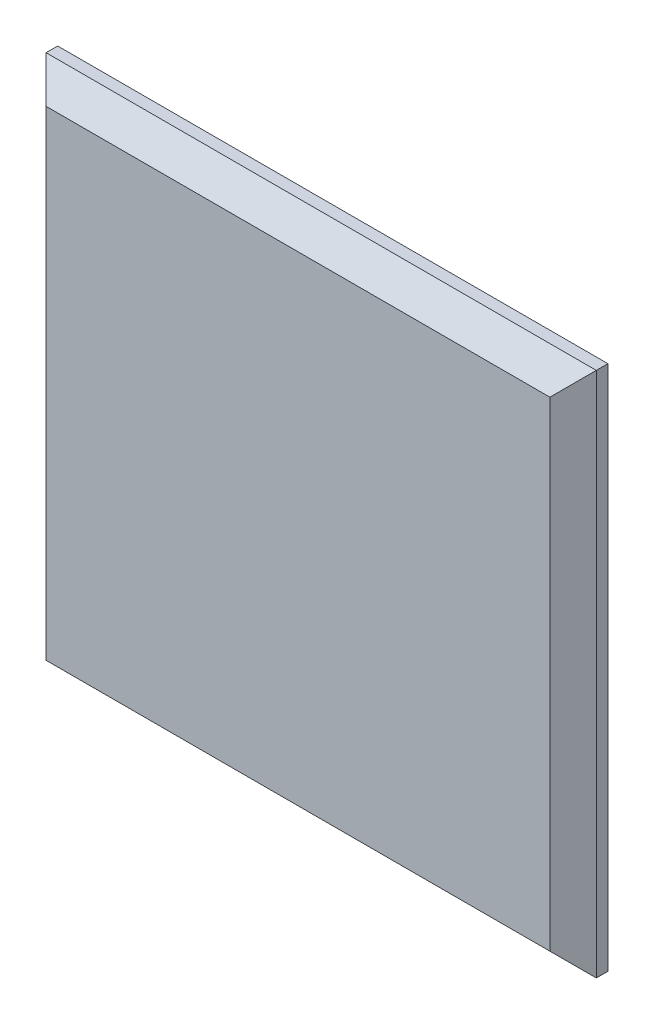
from build123d import *

# Parameters (mm, degrees)
SKETCH1_W           = 142.2
SKETCH1_H           = 136
BOSS_EXTRUDE1_DEPTH = 6
SKETCH2_W           = 142.2
SKETCH2_H           = 136
BOSS_EXTRUDE2_DEPTH = 3
CHAMFER1_SIZE       = 6
CHAMFER2_SIZE       = 4
SKETCH3_R           = 1.55
CUT_EXTRUDE1_DEPTH  = 2.3


with BuildPart() as part:
    # Sketch1 → Boss-Extrude1 (new body)
    with BuildSketch(Plane.XY):
        with Locations((-71.1, 68)):
            Rectangle(SKETCH1_W, SKETCH1_H)
        with BuildLine():
            ThreePointArc((-5, 9.5), (-7.121320344, 8.621320344), (-8, 6.5))
            Line((-8, 6.5), (-8, 5))
            Line((-8, 5), (-132.7, 5))
            Line((-132.7, 5), (-132.7, 6.5))
            ThreePointArc((-132.7, 6.5), (-133.578679656, 8.621320344), (-135.7, 9.5))
            Line((-135.7, 9.5), (-137.2, 9.5))
            Line((-137.2, 9.5), (-137.2, 126.5))
            Line((-137.2, 126.5), (-135.7, 126.5))
            ThreePointArc((-135.7, 126.5), (-133.578679656, 127.378679656), (-132.7, 129.5))
            Line((-132.7, 129.5), (-132.7, 131))
            Line((-132.7, 131), (-8, 131))
            Line((-8, 131), (-8, 129.5))
            ThreePointArc((-8, 129.5), (-7.121320344, 127.378679656), (-5, 126.5))
            Line((-5, 126.5), (-5, 9.5))
        make_face(mode=Mode.SUBTRACT)
    extrude(amount=BOSS_EXTRUDE1_DEPTH)

    # Sketch2 → Boss-Extrude2 (add)
    with BuildSketch(Plane.XY.offset(6)):
        with Locations((-71.1, 68)):
            Rectangle(SKETCH2_W, SKETCH2_H)
    extrude(amount=BOSS_EXTRUDE2_DEPTH)

    # Chamfer1
    chamfer1_edges = [part.edges().sort_by_distance(p)[0] for p in [
        (-142.2, 68, 9),
        (-71.1, 0, 9),
        (0, 68, 9),
        (-71.1, 136, 9),
    ]]
    chamfer(chamfer1_edges, length=CHAMFER1_SIZE)

    # Chamfer2
    # the kernel refuses this chamfer: 4 mm, written as the material it adds along each edge
    with BuildSketch(Plane(origin=(-142.986731952, 131, 6), x_dir=(0, 0.02749587661058907, -0.9996219169112965), z_dir=(1, 0, 0))) as chamfer2_piece_1_section:
        Polygon((CHAMFER2_SIZE * 0.999621916911, -CHAMFER2_SIZE * 0.0274958766106), (-CHAMFER2_SIZE * 0.0274958766106, -CHAMFER2_SIZE * 0.999621916911), (0, 0), align=None)
    chamfer2_piece_1 = extrude(amount=145.273463904, mode=Mode.PRIVATE)
    chamfer2_piece_1 = split(chamfer2_piece_1, bisect_by=Plane(origin=(-142.2, 127.973585933, 5.513207057), z_dir=(1, 0, 0)), keep=Keep.TOP, mode=Mode.PRIVATE)
    chamfer2_piece_1 = split(chamfer2_piece_1, bisect_by=Plane(origin=(0, 127.973585933, 5.513207057), z_dir=(-1, 0, 0)), keep=Keep.TOP, mode=Mode.PRIVATE)
    chamfer2_piece_1 = split(chamfer2_piece_1, bisect_by=Plane(origin=(-136.314439618, 127.973585933, 8.885560382), z_dir=(0.7071067811865476, 0, -0.7071067811865476)), keep=Keep.TOP, mode=Mode.PRIVATE)
    chamfer2_piece_1 = split(chamfer2_piece_1, bisect_by=Plane(origin=(-67.727646674, 127.973585933, 70.727646674), z_dir=(-0.7071067811865476, 0, -0.7071067811865476)), keep=Keep.TOP, mode=Mode.PRIVATE)
    add(chamfer2_piece_1)
    with BuildSketch(Plane(origin=(-5, 136.786731952, 6), x_dir=(0.02749587661058627, 0, -0.9996219169112968), z_dir=(0, -1, 0))) as chamfer2_piece_2_section:
        Polygon((CHAMFER2_SIZE * 0.999621916911, -CHAMFER2_SIZE * 0.0274958766106), (-CHAMFER2_SIZE * 0.0274958766106, -CHAMFER2_SIZE * 0.999621916911), (0, 0), align=None)
    chamfer2_piece_2 = extrude(amount=137.573463904, mode=Mode.PRIVATE)
    chamfer2_piece_2 = split(chamfer2_piece_2, bisect_by=Plane(origin=(-8.333333333, 5, 5.666666667), z_dir=(0, 1, 0)), keep=Keep.TOP, mode=Mode.PRIVATE)
    chamfer2_piece_2 = split(chamfer2_piece_2, bisect_by=Plane(origin=(-8.333333333, 131, 5.666666667), z_dir=(0, -1, 0)), keep=Keep.TOP, mode=Mode.PRIVATE)
    add(chamfer2_piece_2)
    with BuildSketch(Plane(origin=(2.286731952, 5, 6), x_dir=(0, -0.02749587661058627, -0.9996219169112968), z_dir=(-1, 0, 0))) as chamfer2_piece_3_section:
        Polygon((CHAMFER2_SIZE * 0.999621916911, -CHAMFER2_SIZE * 0.0274958766106), (-CHAMFER2_SIZE * 0.0274958766106, -CHAMFER2_SIZE * 0.999621916911), (0, 0), align=None)
    chamfer2_piece_3 = extrude(amount=145.273463904, mode=Mode.PRIVATE)
    chamfer2_piece_3 = split(chamfer2_piece_3, bisect_by=Plane(origin=(-142.2, 8.026414067, 5.513207057), z_dir=(1, 0, 0)), keep=Keep.TOP, mode=Mode.PRIVATE)
    chamfer2_piece_3 = split(chamfer2_piece_3, bisect_by=Plane(origin=(0, 8.026414067, 5.513207057), z_dir=(-1, 0, 0)), keep=Keep.TOP, mode=Mode.PRIVATE)
    chamfer2_piece_3 = split(chamfer2_piece_3, bisect_by=Plane(origin=(-73.722353326, 8.026414067, 71.477646674), z_dir=(0.7071067811865476, 0, -0.7071067811865476)), keep=Keep.TOP, mode=Mode.PRIVATE)
    chamfer2_piece_3 = split(chamfer2_piece_3, bisect_by=Plane(origin=(-5.135560382, 8.026414067, 8.135560382), z_dir=(-0.7071067811865476, 0, -0.7071067811865476)), keep=Keep.TOP, mode=Mode.PRIVATE)
    add(chamfer2_piece_3)
    with BuildSketch(Plane(origin=(-137.2, -0.786731952, 6), x_dir=(-0.02749587661058907, 0, -0.9996219169112965), z_dir=(0, 1, 0))) as chamfer2_piece_4_section:
        Polygon((CHAMFER2_SIZE * 0.999621916911, -CHAMFER2_SIZE * 0.0274958766106), (-CHAMFER2_SIZE * 0.0274958766106, -CHAMFER2_SIZE * 0.999621916911), (0, 0), align=None)
    chamfer2_piece_4 = extrude(amount=137.573463904, mode=Mode.PRIVATE)
    chamfer2_piece_4 = split(chamfer2_piece_4, bisect_by=Plane(origin=(-134.173585933, 0, 5.513207057), z_dir=(0, 1, 0)), keep=Keep.TOP, mode=Mode.PRIVATE)
    chamfer2_piece_4 = split(chamfer2_piece_4, bisect_by=Plane(origin=(-134.173585933, 5.885560382, 8.885560382), z_dir=(0, 0.7071067811865476, -0.7071067811865476)), keep=Keep.TOP, mode=Mode.PRIVATE)
    chamfer2_piece_4 = split(chamfer2_piece_4, bisect_by=Plane(origin=(-134.173585933, 136, 5.513207057), z_dir=(0, -1, 0)), keep=Keep.TOP, mode=Mode.PRIVATE)
    chamfer2_piece_4 = split(chamfer2_piece_4, bisect_by=Plane(origin=(-134.173585933, 71.372353326, 67.627646674), z_dir=(0, -0.7071067811865476, -0.7071067811865476)), keep=Keep.TOP, mode=Mode.PRIVATE)
    add(chamfer2_piece_4)

    # Sketch3 → Cut-Extrude1 (cut)
    with BuildSketch(Plane(origin=(0, 0, 0), x_dir=(-1, 0, 0), z_dir=(0, 0, -1))):
        with Locations((135.7, 129.5)):
            Circle(SKETCH3_R)
        with Locations((135.7, 6.5)):
            Circle(SKETCH3_R)
        with Locations((5, 6.5)):
            Circle(SKETCH3_R)
        with Locations((5, 129.5)):
            Circle(SKETCH3_R)
    extrude(amount=-CUT_EXTRUDE1_DEPTH, mode=Mode.SUBTRACT)


solid = part.part
